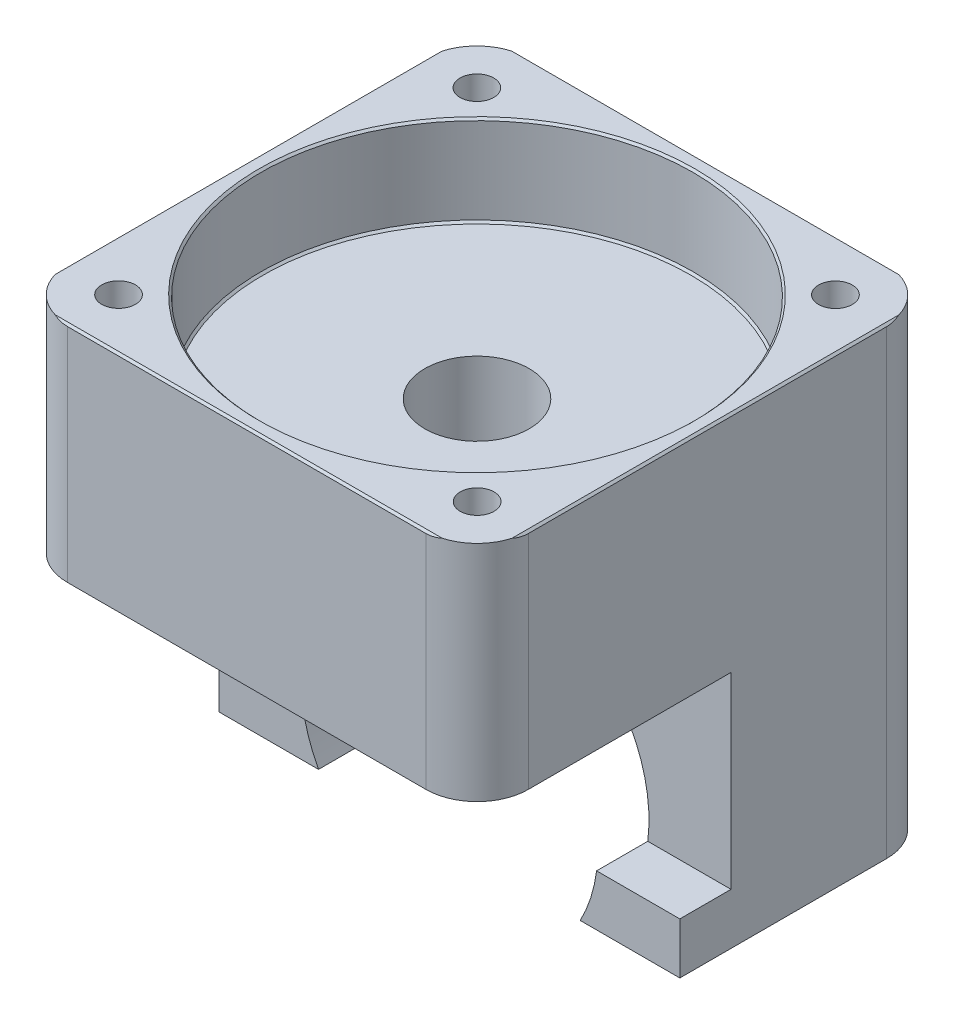
from build123d import *

# Parameters (mm, degrees)
SKETCH1_W                                  = 45.025374044
SKETCH1_H                                  = 45
BOSS_EXTRUDE1_DEPTH                        = 60
SKETCH2_R                                  = 21.1
CUT_EXTRUDE1_DEPTH                         = 8.8
SKETCH3_R                                  = 5.1
CUT_EXTRUDE2_DEPTH                         = 11.8
CHAMFER1_SIZE                              = 0.2
SKETCH4_R                                  = 14.5
CUT_EXTRUDE3_DEPTH                         = 79.305945349
SKETCH5_W                                  = 45.025374044
SKETCH5_H                                  = 45
CUT_EXTRUDE4_DEPTH                         = 14.8
SKETCH6_W                                  = 45.025374044
SKETCH6_H                                  = 23.350654293
CUT_EXTRUDE5_DEPTH                         = 24.8
FILLET3_R                                  = 5
FILLET4_R                                  = 5
FILLET7_R                                  = 5
FILLET8_R                                  = 5
BOSS_EXTRUDE3_START                        = 5
BOSS_EXTRUDE3_DEPTH                        = 5
SKETCH9_R                                  = 1.65
CUT_EXTRUDE6_DEPTH                         = 5
MIRROR2_AT_THE_SECOND_PLANE_COPY_1_SKETC_R = 1.65
MIRROR2_AT_THE_SECOND_PLANE_COPY_1_DEPTH   = 5


with BuildPart() as part:
    # Sketch1 → Boss-Extrude1 (new body)
    with BuildSketch(Plane(origin=(0, 0, 0), x_dir=(1, 0, 0), z_dir=(0, 1, 0))):
        Rectangle(SKETCH1_W, SKETCH1_H)
    extrude(amount=BOSS_EXTRUDE1_DEPTH)

    # Sketch2 → Cut-Extrude1 (cut)
    with BuildSketch(Plane(origin=(0, 60, 0), x_dir=(1, 0, 0), z_dir=(0, 1, 0))):
        with Locations(Location((0, 0, 0), (0, 0, 270))):
            Circle(SKETCH2_R)
    extrude(amount=-CUT_EXTRUDE1_DEPTH, mode=Mode.SUBTRACT)

    # Sketch3 → Cut-Extrude2 (cut)
    with BuildSketch(Plane(origin=(0, 51.2, 0), x_dir=(1, 0, 0), z_dir=(0, 1, 0))):
        with Locations(Location((0, 0, 0), (0, 0, 270))):
            Circle(SKETCH3_R)
    extrude(amount=-CUT_EXTRUDE2_DEPTH, mode=Mode.SUBTRACT)

    # Chamfer1
    chamfer1_edges = [part.edges().sort_by_distance(p)[0] for p in [
        (-22.512687022, 60, 0),
        (0, 51.2, -21.1),
        (0, 60, -21.1),
        (0, 60, 22.5),
        (22.512687022, 60, 0),
        (0, 60, -22.5),
    ]]
    chamfer(chamfer1_edges, length=CHAMFER1_SIZE)

    # Sketch4 → Cut-Extrude3 (cut, through all)
    with BuildSketch(Plane.XY.offset(22.5)):
        with Locations((0, 21.650654293)):
            Circle(SKETCH4_R)
    extrude(amount=-CUT_EXTRUDE3_DEPTH, mode=Mode.SUBTRACT)

    # Sketch5 → Cut-Extrude4 (cut)
    with BuildSketch(Plane.XZ):
        Rectangle(SKETCH5_W, SKETCH5_H)
    extrude(amount=-CUT_EXTRUDE4_DEPTH, mode=Mode.SUBTRACT)

    # Sketch6 → Cut-Extrude5 (cut)
    with BuildSketch(Plane.XY.offset(22.5)):
        with Locations((0, 26.475327146)):
            Rectangle(SKETCH6_W, SKETCH6_H)
    extrude(amount=-CUT_EXTRUDE5_DEPTH, mode=Mode.SUBTRACT)

    # Fillet3
    # the kernel refuses this fillet: 5 mm, written as the material it takes off along each edge
    with BuildSketch(Plane(origin=(22.512687022, 2.3, -22.5), x_dir=(0, 0, 1), z_dir=(0, 1, 0))) as fillet3_piece_1:
        with BuildLine():
            CenterArc((FILLET3_R, -FILLET3_R), FILLET3_R, 90, 90)
            Line((0, -FILLET3_R), (0, 0))
            Line((0, 0), (FILLET3_R, 0))
        make_face()
    extrude(amount=70, mode=Mode.SUBTRACT)

    # Fillet4
    # the kernel refuses this fillet: 5 mm, written as the material it takes off along each edge
    with BuildSketch(Plane(origin=(-22.512687022, 2.3, -22.5), x_dir=(0, 0, 1), z_dir=(0, 1, 0))) as fillet4_piece_1:
        with BuildLine():
            CenterArc((FILLET4_R, FILLET4_R), FILLET4_R, 180, 90)
            Line((0, FILLET4_R), (0, 0))
            Line((0, 0), (FILLET4_R, 0))
        make_face()
    extrude(amount=70, mode=Mode.SUBTRACT)

    # Fillet7
    # the kernel refuses this fillet: 5 mm, written as the material it takes off along each edge
    with BuildSketch(Plane(origin=(22.512687022, 25.650654293, 22.5), x_dir=(-1, 0, 0), z_dir=(0, 1, 0))) as fillet7_piece_1:
        with BuildLine():
            CenterArc((FILLET7_R, -FILLET7_R), FILLET7_R, 90, 90)
            Line((0, -FILLET7_R), (0, 0))
            Line((0, 0), (FILLET7_R, 0))
        make_face()
    extrude(amount=46.649345707, mode=Mode.SUBTRACT)

    # Fillet8
    # the kernel refuses this fillet: 5 mm, written as the material it takes off along each edge
    with BuildSketch(Plane(origin=(-22.512687022, 25.650654293, 22.5), x_dir=(1, 0, 0), z_dir=(0, 1, 0))) as fillet8_piece_1:
        with BuildLine():
            CenterArc((FILLET8_R, FILLET8_R), FILLET8_R, 180, 90)
            Line((0, FILLET8_R), (0, 0))
            Line((0, 0), (FILLET8_R, 0))
        make_face()
    extrude(amount=46.649345707, mode=Mode.SUBTRACT)

    # Sketch7 → Boss-Extrude3 (add)
    with BuildSketch(Plane.XY.offset(-2.3).offset(BOSS_EXTRUDE3_START)):
        with BuildLine():
            Line((-22.512687022, 14.8), (-12.779614069, 14.8))
            ThreePointArc((-12.779614069, 14.8), (-13.808706174, 17.22689641), (-14.381414349, 19.8))
            Line((-14.381414349, 19.8), (-22.512687022, 19.8))
            Line((-22.512687022, 19.8), (-22.512687022, 14.8))
        make_face()
    boss_extrude3 = extrude(amount=-BOSS_EXTRUDE3_DEPTH)

    # Mirror1: Boss-Extrude3 across plane
    add(boss_extrude3.mirror(Plane(origin=(0, 0, 0), x_dir=(0, 0, 1), z_dir=(1, 0, 0))))

    # Sketch9 → Cut-Extrude6 (cut)
    with BuildSketch(Plane(origin=(0, 60, 0), x_dir=(1, 0, 0), z_dir=(0, 1, 0))):
        with Locations(Location((-17.512687022, 17.5, 0), (0, 0, 270))):
            Circle(SKETCH9_R)
    cut_extrude6 = extrude(amount=-CUT_EXTRUDE6_DEPTH, mode=Mode.SUBTRACT)

    # Mirror2: Cut-Extrude6 across plane
    add(cut_extrude6.mirror(Plane(origin=(0, 0, 0), x_dir=(0, 0, 1), z_dir=(1, 0, 0))), mode=Mode.SUBTRACT)

    # Mirror2 at the second plane: Cut-Extrude6 across plane
    add(cut_extrude6.mirror(Plane.XY), mode=Mode.SUBTRACT)

    # Mirror2 at the second plane copy 1 sketc → Mirror2 at the second plane copy 1 (cut)
    with BuildSketch(Plane(origin=(0, 60, 0), x_dir=(-1, 0, 0), z_dir=(0, 1, 0))):
        with Locations(Location((-17.512687022, 17.5, 0), (0, 0, 270))):
            Circle(MIRROR2_AT_THE_SECOND_PLANE_COPY_1_SKETC_R)
    extrude(amount=-MIRROR2_AT_THE_SECOND_PLANE_COPY_1_DEPTH, mode=Mode.SUBTRACT)


solid = part.part
